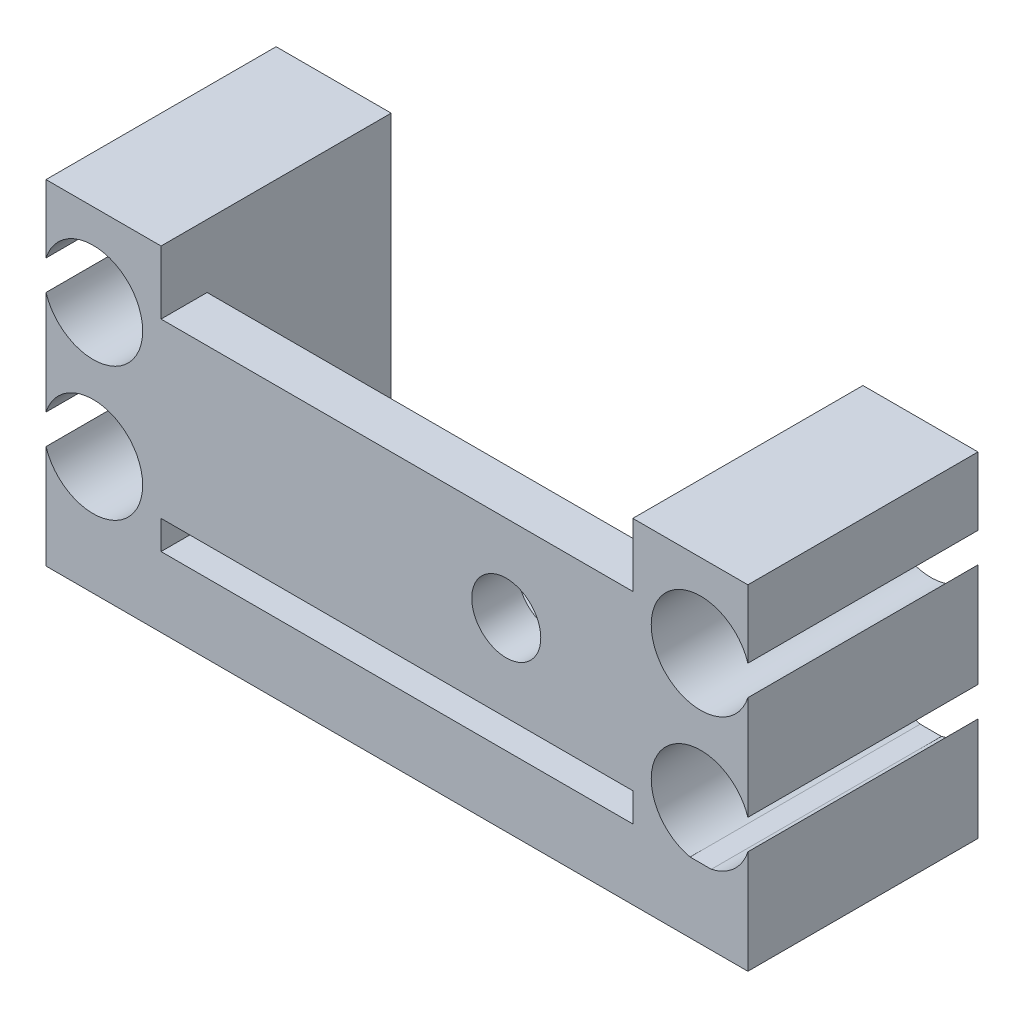
from build123d import *

# Parameters (mm, degrees)
EXTRUDE_1_DEPTH     = 20
SKETCH_5_R          = 3
EXTRUDE_6_DEPTH     = 4
CUT_EXTRUDE_1_DEPTH = 79.076136853


with BuildPart() as part:
    # Эскиз1 → Бобышка-Вытянуть1 (new body)
    with BuildSketch(Plane.XY):
        Polygon((-61.190561798, -40.176897727), (-61.190561798, -15.085730337), (-51.190561798, -15.085730337), (-51.190561798, -38.085730337), (-10.190561798, -38.085730337), (-10.190561798, -15.085730337), (-0.190561798, -15.085730337), (-0.190561798, -38.085730337), (-0.190561798, -44.176897727), (-61.190561798, -44.176897727), align=None)
    extrude(amount=EXTRUDE_1_DEPTH)

    # Эскиз5 → Бобышка-Вытянуть6 (add)
    with BuildSketch(Plane.XY.offset(20)):
        Polygon((-21.190561798, -35.58573034), (-51.190561798, -35.58573034), (-51.190561798, -20.58573034), (-21.190561798, -20.58573034), (-10.190561798, -20.58573034), (-10.190561798, -35.58573034), align=None)
        with Locations((-21.190561798, -28.085730337)):
            Circle(SKETCH_5_R, mode=Mode.SUBTRACT)
    extrude(amount=-EXTRUDE_6_DEPTH)

    # Эскиз6 → Вырез-Вытянуть1 (cut, through all)
    with BuildSketch(Plane.XY.offset(20)):
        with BuildLine():
            ThreePointArc((-0.190561798, -20.989582197), (-8.590561798, -22.285730337), (-0.190561798, -23.581878477))
            Line((-0.190561798, -23.581878477), (-0.190561798, -20.989582197))
        make_face()
        with BuildLine():
            ThreePointArc((-0.190561798, -32.589582197), (-7.464975835, -30.985196676), (-5.212516243, -38.085730337))
            Line((-5.212516243, -38.085730337), (-3.368607352, -38.085730337))
            ThreePointArc((-3.368607352, -38.085730337), (-1.390028136, -37.060144374), (-0.190561798, -35.181878477))
            Line((-0.190561798, -35.181878477), (-0.190561798, -32.589582197))
        make_face()
        with BuildLine():
            ThreePointArc((-61.190561798, -23.581878477), (-52.790561798, -22.285730337), (-61.190561798, -20.989582197))
            Line((-61.190561798, -20.989582197), (-61.190561798, -23.581878477))
        make_face()
        with BuildLine():
            ThreePointArc((-61.190561798, -35.181878477), (-52.790561798, -33.885730337), (-61.190561798, -32.589582197))
            Line((-61.190561798, -32.589582197), (-61.190561798, -35.181878477))
        make_face()
    extrude(amount=-CUT_EXTRUDE_1_DEPTH, mode=Mode.SUBTRACT)


solid = part.part
